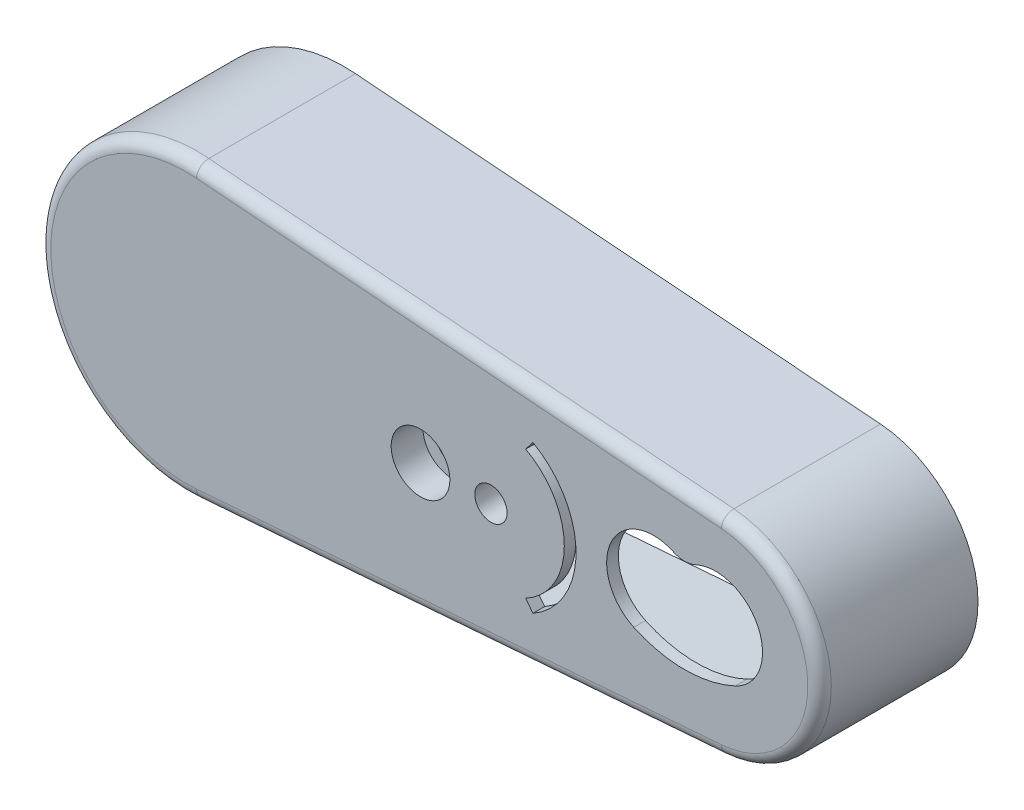
from build123d import *
from build123d.topology import SkipClean

# Parameters (mm, degrees)
AUFSATZ_LINEAR_AUSTRAGEN1_DEPTH                      = 25
AUFSATZ_LINEAR_AUSTRAGEN2_DEPTH                      = 2
VERRUNDUNG1_R                                        = 2
SCHNITT_LINEAR_AUSTRAGEN1_REACH                      = 116.096
AUFSATZ_LINEAR_AUSTRAGEN3_DEPTH                      = 25
SPIEGELN2_DEPTH                                      = 25
STIRNSENKUNG_F_R_M5_ZYLINDERSCHRAUBE_MIT_D           = 5.5
STIRNSENKUNG_F_R_M5_ZYLINDERSCHRAUBE_MIT_CBORE_D     = 10
STIRNSENKUNG_F_R_M5_ZYLINDERSCHRAUBE_MIT_CBORE_DEPTH = 5.4
DURCHGANGSLOCH_F_R_M51_D                             = 5.5
SCHNITT_LINEAR_AUSTRAGEN2_REACH                      = 116.096


# Read off the part's stored shape, not the designer's step: Spiegeln2
with BuildPart() as part:
    # Skizze1 → Aufsatz-Linear austragen1 (new body)
    with BuildSketch(Plane.XY):
        with BuildLine():
            Line((1.944444444, 24.924268009), (91.4, 17.945472967))
            ThreePointArc((91.4, 17.945472967), (103.213629327, 12.222929272), (108, 0))
            Line((108, 0), (106.5, 0))
            ThreePointArc((106.5, 0), (102.11249355, 11.204351833), (91.283333333, 16.450016886))
            Line((91.283333333, 16.450016886), (1.827777778, 23.428811929))
            ThreePointArc((1.827777778, 23.428811929), (-15.957713217, 17.251127177), (-23.5, 0))
            Line((-23.5, 0), (-25, 0))
            ThreePointArc((-25, 0), (-16.976290656, 18.352262955), (1.944444444, 24.924268009))
        make_face()
    extrude(amount=AUFSATZ_LINEAR_AUSTRAGEN1_DEPTH)

    # Skizze2 → Aufsatz-Linear austragen2 (add)
    with BuildSketch(Plane.XY.offset(25)):
        with BuildLine():
            Line((108, 0), (-25, 0))
            ThreePointArc((-25, 0), (-16.976290656, 18.352262955), (1.944444444, 24.924268009))
            Line((1.944444444, 24.924268009), (91.4, 17.945472967))
            ThreePointArc((91.4, 17.945472967), (103.213629327, 12.222929272), (108, 0))
        make_face()
    extrude(amount=AUFSATZ_LINEAR_AUSTRAGEN2_DEPTH)

    # Verrundung1
    verrundung1_edges = [part.edges().sort_by_distance(p)[0] for p in [
        (-15.957713217, 17.251127177, 25),
        (46.555555556, 19.939414407, 25),
        (-16.976290656, 18.352262955, 27),
        (102.11249355, 11.204351833, 25),
        (103.213629327, 12.222929272, 27),
        (46.672222222, 21.434870488, 27),
    ]]
    fillet(verrundung1_edges, radius=VERRUNDUNG1_R)

    # Spiegeln1: part across plane


with BuildPart() as part_1:
    with SkipClean():  # the faces are left unmerged after this step: merging them gives an invalid solid
        add(part.part)
        add(part.part.mirror(Plane.ZX))

    # Skizze11 → Schnitt-Linear austragen1 (cut, up to next)
    with BuildSketch(Plane.XY.offset(27), mode=Mode.PRIVATE) as schnitt_linear_austragen1_sk1:
        with BuildLine():
            Line((85, 0), (85, 8))
            ThreePointArc((85, 8), (85.973978263, 8.106667968), (86.901782178, 8.421614958))
            ThreePointArc((86.901782178, 8.421614958), (97.533190568, 4.552098756), (93.663674366, -6.079309634))
            ThreePointArc((93.663674366, -6.079309634), (89.437012086, -7.514068146), (85, -8))
            Line((85, -8), (85, 0))
        make_face()
    schnitt_linear_austragen1_tool1 = extrude(schnitt_linear_austragen1_sk1.sketch, amount=-SCHNITT_LINEAR_AUSTRAGEN1_REACH, mode=Mode.PRIVATE) & part_1.part
    schnitt_linear_austragen1 = schnitt_linear_austragen1_tool1.solids().sort_by_distance((90.892741, 0.809501, 27))[0]
    add(schnitt_linear_austragen1, mode=Mode.SUBTRACT)

    # Spiegeln3: Schnitt-Linear austragen1 across plane
    with SkipClean():  # the faces are left unmerged after this step: merging them gives an invalid solid
        add(schnitt_linear_austragen1.mirror(Plane(origin=(85, 0, -0.001), x_dir=(0, 0, 1), z_dir=(-1, 0, 0))), mode=Mode.SUBTRACT)

    # Skizze3 → Aufsatz-Linear austragen3 (add)
    with SkipClean():  # the faces are left unmerged after this step: merging them gives an invalid solid
        with BuildSketch(Plane.XY):
            with BuildLine():
                Line((46, 6), (46, 0))
                Line((46, 0), (34, 0))
                ThreePointArc((34, 0), (35.757359313, 4.242640687), (40, 6))
                Line((40, 6), (46, 6))
            make_face()
        extrude(amount=AUFSATZ_LINEAR_AUSTRAGEN3_DEPTH)

    # Spiegeln2 outline → Spiegeln2 (add)
    with SkipClean():  # the faces are left unmerged after this step: merging them gives an invalid solid
        with BuildSketch(Plane.XY):
            with BuildLine():
                Line((52, 6), (46, 6))
                Line((46, 6), (46, 0))
                Line((46, 0), (34, 0))
                ThreePointArc((34, 0), (35.757359313, -4.242640687), (40, -6))
                Line((40, -6), (52, -6))
                ThreePointArc((52, -6), (58, 0), (52, 6))
            make_face()
        extrude(amount=SPIEGELN2_DEPTH)

    # Stirnsenkung für M5 Zylinderschraube mit Innensechskant2 (through all)
    with Locations(Plane.XY.offset(27)):
        with Locations((40, 0)):
            CounterBoreHole(STIRNSENKUNG_F_R_M5_ZYLINDERSCHRAUBE_MIT_D / 2, STIRNSENKUNG_F_R_M5_ZYLINDERSCHRAUBE_MIT_CBORE_D / 2, STIRNSENKUNG_F_R_M5_ZYLINDERSCHRAUBE_MIT_CBORE_DEPTH)

    # Durchgangsloch für M51 (through all)
    with Locations(Plane.XY.offset(27)):
        with Locations((52, 0)):
            Hole(DURCHGANGSLOCH_F_R_M51_D / 2)

    # Skizze12 → Schnitt-Linear austragen2 (cut, up to next)
    with BuildSketch(Plane.XY.offset(27), mode=Mode.PRIVATE) as schnitt_linear_austragen2_sk1:
        with BuildLine():
            Line((59.155963734, -12.611192768), (57.924777873, -11.006680115))
            ThreePointArc((57.924777873, -11.006680115), (64.5, 0), (57.924777873, 11.006680115))
            Line((57.924777873, 11.006680115), (59.155963734, 12.611192768))
            ThreePointArc((59.155963734, 12.611192768), (60.01066697, 12.086323457), (60.827040721, 11.503623434))
            ThreePointArc((60.827040721, 11.503623434), (66.5, 0), (60.827040721, -11.503623434))
            ThreePointArc((60.827040721, -11.503623434), (60.01066697, -12.086323457), (59.155963734, -12.611192768))
        make_face()
    schnitt_linear_austragen2_tool1 = extrude(schnitt_linear_austragen2_sk1.sketch, amount=-SCHNITT_LINEAR_AUSTRAGEN2_REACH, mode=Mode.PRIVATE) & part_1.part
    add(schnitt_linear_austragen2_tool1.solids().sort_by_distance((58.751722, -11.646761, 27))[0], mode=Mode.SUBTRACT)


solid = part_1.part
